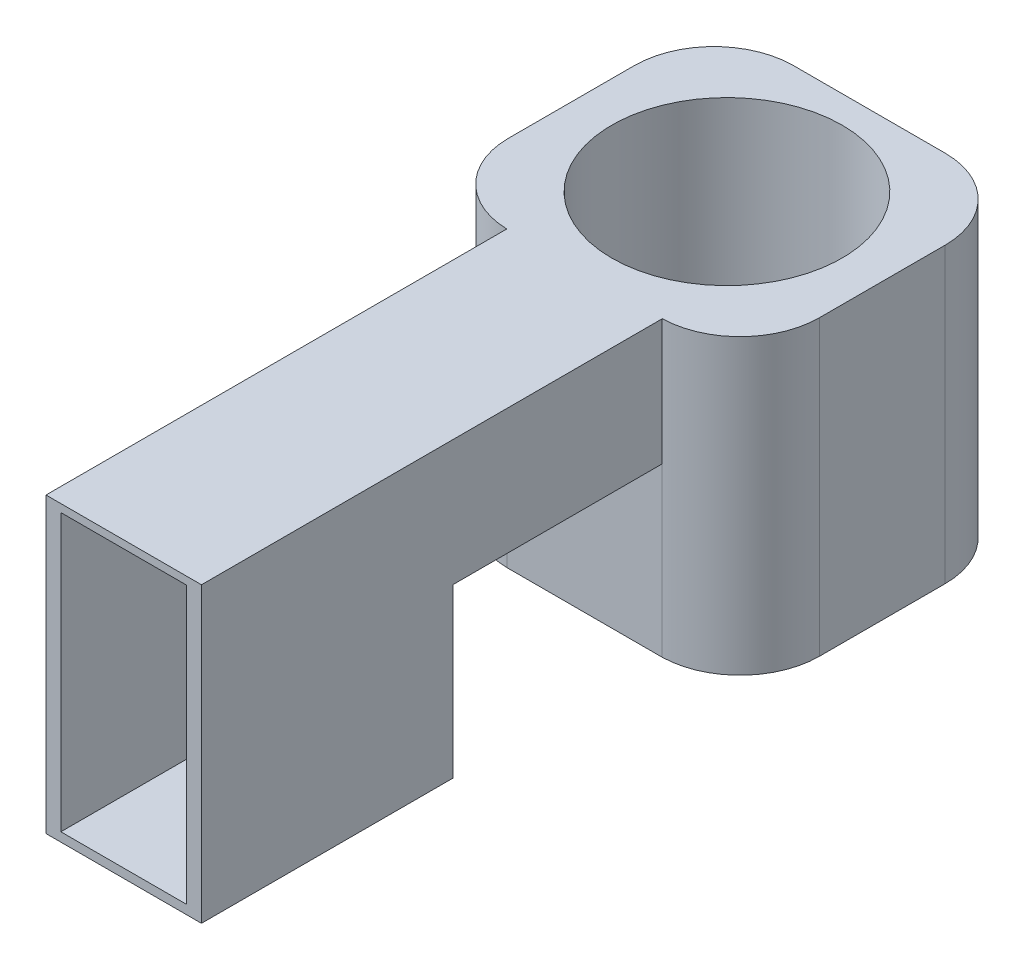
from build123d import *

# Parameters (mm, degrees)
SKETCH1_W           = 74.22368895
SKETCH1_H           = 68
SKETCH1_W_2         = 37.111844475
SKETCH1_H_2         = 52
SKETCH1_H_3         = 58
BOSS_EXTRUDE1_DEPTH = 70
SKETCH2_R           = 27.5
CUT_EXTRUDE1_DEPTH  = 70
FILLET1_R           = 19
SKETCH3_W           = 33.111844475
SKETCH3_H           = 64.288874977
CUT_EXTRUDE2_DEPTH  = 58
SKETCH5_W           = 50
SKETCH5_H           = 40
CUT_EXTRUDE3_DEPTH  = 58
SKETCH7_W           = 29.516350972
SKETCH7_H           = 18.630296647
CUT_EXTRUDE5_DEPTH  = 58
SKETCH8_W           = 33.111844475
SKETCH8_H           = 2
CUT_EXTRUDE6_DEPTH  = 58
SKETCH9_W           = 1.55
SKETCH9_H           = 66.288874977
BOSS_EXTRUDE2_DEPTH = 58
SKETCH10_W          = 30.011844475
SKETCH10_H          = 0.145
BOSS_EXTRUDE3_DEPTH = 58


with BuildPart() as part:
    # Sketch1 → Boss-Extrude1 (new body)
    with BuildSketch(Plane(origin=(0, 0, 0), x_dir=(1, 0, 0), z_dir=(0, 1, 0))):
        with Locations((-37.111844475, -34)):
            Rectangle(SKETCH1_W, SKETCH1_H)
        with Locations((-37.111844475, -94)):
            Rectangle(SKETCH1_W_2, SKETCH1_H_2)
        with Locations((-37.111844475, -149)):
            Rectangle(SKETCH1_W_2, SKETCH1_H_3)
    extrude(amount=-BOSS_EXTRUDE1_DEPTH)

    # Sketch2 → Cut-Extrude1 (cut)
    with BuildSketch(Plane(origin=(0, 0, 0), x_dir=(1, 0, 0), z_dir=(0, 1, 0))):
        with Locations(Location((-37.111844475, -34, 0), (0, 0, 270))):
            Circle(SKETCH2_R)
    extrude(amount=-CUT_EXTRUDE1_DEPTH, mode=Mode.SUBTRACT)

    # Fillet1
    # the kernel refuses this fillet: 19 mm, written as the material it takes off along each edge
    with BuildSketch(Plane(origin=(0, 47.487024211, 68), x_dir=(0, 0, -1), z_dir=(0, -1, 0))) as fillet1_piece_1:
        with BuildLine():
            CenterArc((18.994809684, -19), FILLET1_R, 90, 88.660731648)
            Line((0, -18.555922237), (-0.379896194, -18.547040682))
            ThreePointArc((-0.379896194, -18.547040682), (-0.38, -9.277961119), (-0.38, 0))
            Line((-0.38, 0), (0, 0.38))
            Line((0, 0.38), (18.994809684, 0.38))
            Line((18.994809684, 0.38), (18.994809684, 0))
        make_face()
    extrude(amount=164.974048421, mode=Mode.SUBTRACT)
    with BuildSketch(Plane(origin=(0, 47.5, 0), x_dir=(-1, 0, 0), z_dir=(0, -1, 0))) as fillet1_piece_2:
        with BuildLine():
            CenterArc((FILLET1_R, -FILLET1_R), FILLET1_R, 90, 90)
            Line((0, -FILLET1_R), (-FILLET1_R * 0.02, -FILLET1_R))
            Line((-FILLET1_R * 0.02, -FILLET1_R), (-FILLET1_R * 0.02, FILLET1_R * 0.02))
            Line((-FILLET1_R * 0.02, FILLET1_R * 0.02), (FILLET1_R, FILLET1_R * 0.02))
            Line((FILLET1_R, FILLET1_R * 0.02), (FILLET1_R, 0))
        make_face()
    extrude(amount=165, mode=Mode.SUBTRACT)
    with BuildSketch(Plane(origin=(-74.22368895, 47.487024211, 68), x_dir=(0, 0, -1), z_dir=(0, -1, 0))) as fillet1_piece_3:
        with BuildLine():
            CenterArc((18.994809684, 19), FILLET1_R, 181.339268352, 88.660731648)
            Line((0, 18.555922237), (-0.379896194, 18.547040682))
            ThreePointArc((-0.379896194, 18.547040682), (-0.38, 9.277961119), (-0.38, 0))
            Line((-0.38, 0), (0, -0.38))
            Line((0, -0.38), (18.994809684, -0.38))
            Line((18.994809684, -0.38), (18.994809684, 0))
        make_face()
    extrude(amount=164.974048421, mode=Mode.SUBTRACT)
    with BuildSketch(Plane(origin=(-74.22368895, 47.5, 0), x_dir=(1, 0, 0), z_dir=(0, -1, 0))) as fillet1_piece_4:
        with BuildLine():
            CenterArc((FILLET1_R, FILLET1_R), FILLET1_R, 180, 90)
            Line((0, FILLET1_R), (-FILLET1_R * 0.02, FILLET1_R))
            Line((-FILLET1_R * 0.02, FILLET1_R), (-FILLET1_R * 0.02, -FILLET1_R * 0.02))
            Line((-FILLET1_R * 0.02, -FILLET1_R * 0.02), (FILLET1_R, -FILLET1_R * 0.02))
            Line((FILLET1_R, -FILLET1_R * 0.02), (FILLET1_R, 0))
        make_face()
    extrude(amount=165, mode=Mode.SUBTRACT)

    # Sketch3 → Cut-Extrude2 (cut)
    with BuildSketch(Plane.XY.offset(178)):
        with Locations((-37.111844475, -35.855562511)):
            Rectangle(SKETCH3_W, SKETCH3_H)
    extrude(amount=-CUT_EXTRUDE2_DEPTH, mode=Mode.SUBTRACT)

    # Sketch5 → Cut-Extrude3 (cut)
    with BuildSketch(Plane.ZY.offset(55.667766712)):
        with Locations((93, -50)):
            Rectangle(SKETCH5_W, SKETCH5_H)
    extrude(amount=-CUT_EXTRUDE3_DEPTH, mode=Mode.SUBTRACT)

    # Sketch7 → Cut-Extrude5 (cut)
    with BuildSketch(Plane(origin=(0, 0, 118), x_dir=(-1, 0, 0), z_dir=(0, 0, -1))):
        with Locations((37.314097723, -50.684851677)):
            Rectangle(SKETCH7_W, SKETCH7_H)
    extrude(amount=-CUT_EXTRUDE5_DEPTH, mode=Mode.SUBTRACT)

    # Sketch8 → Cut-Extrude6 (cut)
    with BuildSketch(Plane.XY.offset(178)):
        with Locations((-37.111844475, -2.711125023)):
            Rectangle(SKETCH8_W, SKETCH8_H)
    extrude(amount=-CUT_EXTRUDE6_DEPTH, mode=Mode.SUBTRACT)

    # Sketch9 → Boss-Extrude2 (add)
    with BuildSketch(Plane.XY.offset(178)):
        with Locations((-52.892766712, -34.855562511)):
            Rectangle(SKETCH9_W, SKETCH9_H)
        with Locations((-21.330922237, -34.855562511)):
            Rectangle(SKETCH9_W, SKETCH9_H)
    extrude(amount=-BOSS_EXTRUDE2_DEPTH)

    # Sketch10 → Boss-Extrude3 (add)
    with BuildSketch(Plane.XY.offset(178)):
        with Locations((-37.111844475, -67.9275)):
            Rectangle(SKETCH10_W, SKETCH10_H)
        with Locations((-37.111844475, -1.783625023)):
            Rectangle(SKETCH10_W, SKETCH10_H)
    extrude(amount=-BOSS_EXTRUDE3_DEPTH)


solid = part.part
